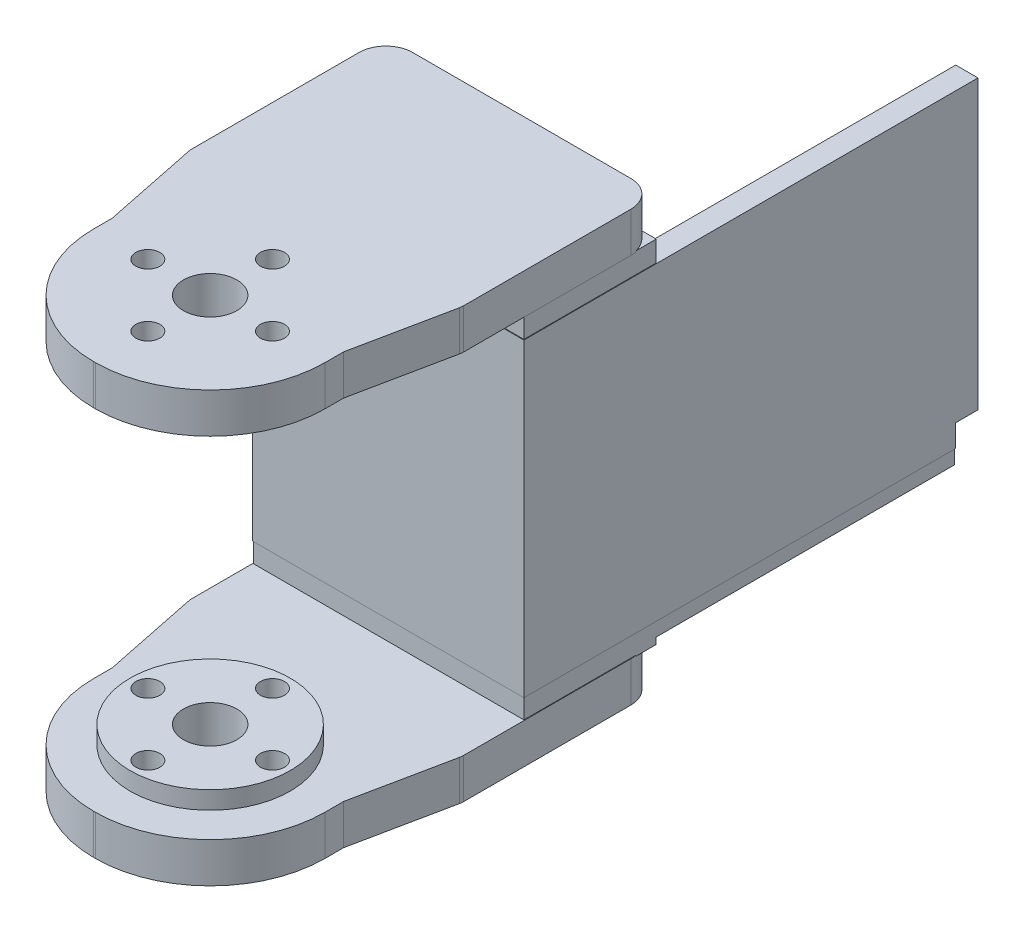
from build123d import *

# Parameters (mm, degrees)
BOSS_1_DEPTH    = 4.5
S_CYL2_R        = 9
BOSS_2_DEPTH    = 2
BOSS_3_DEPTH    = 4.5
S_BOX4_W        = 30.52
S_BOX4_H        = 34.8
BOSS_4_DEPTH    = 2.5
S_BOX5_W        = 2.5
S_BOX5_H        = 34.8
BOSS_5_DEPTH    = 51.02
S_BOX6_W        = 30.52
S_BOX6_H        = 2.4
BOSS_6_DEPTH    = 51.02
S_BOX7_W        = 2.5
S_BOX7_H        = 34.8
BOSS_7_DEPTH    = 18.01
S_BOX8_W        = 30.38
S_BOX8_H        = 2.675
BOSS_8_DEPTH    = 14.87
S_BOX9_W        = 30.38
S_BOX9_H        = 2.425
BOSS_9_DEPTH    = 14.87
S_BOX10_W       = 30.38
S_BOX10_H       = 1.65
BOSS_10_DEPTH   = 37.94
S_BOX11_W       = 5.59
S_BOX11_H       = 1.65
BOSS_11_DEPTH   = 10.54
S_BOX12_W       = 5.59
S_BOX12_H       = 1.65
BOSS_12_DEPTH   = 10.54
S_HOLE13_R      = 3
HOLE_13_DEPTH   = 4.7
S_HOLE14_R      = 1.35
HOLE_14_DEPTH   = 4.7
S_HOLE15_R      = 1.35
HOLE_15_DEPTH   = 4.7
S_HOLE16_R      = 1.35
HOLE_16_DEPTH   = 4.7
S_HOLE17_R      = 1.35
HOLE_17_DEPTH   = 4.7
S_HOLE18_R      = 3
HOLE_18_DEPTH   = 6.7
S_HOLE19_R      = 1.35
HOLE_19_DEPTH   = 6.7
S_HOLE20_R      = 1.35
HOLE_20_DEPTH   = 6.7
S_HOLE21_R      = 1.35
HOLE_21_DEPTH   = 6.7
S_HOLE22_R      = 1.35
HOLE_22_DEPTH   = 6.7
S_HOLE23_R      = 11
HOLE_23_DEPTH   = 2.6
S_HOLE24_R      = 1.1
HOLE_24_DEPTH   = 2.6
S_HOLE25_R      = 1.1
HOLE_25_DEPTH   = 2.6
S_HOLE26_R      = 1.1
HOLE_26_DEPTH   = 2.6
S_CUT27_W       = 30.72
S_CUT27_H       = 2.6
POCKET_27_DEPTH = 2.6
S_HOLE28_R      = 2.5
HOLE_28_DEPTH   = 5.175
S_HOLE29_R      = 2.5
HOLE_29_DEPTH   = 5.175
S_HOLE30_R      = 10
HOLE_30_DEPTH   = 1.8
S_HOLE31_R      = 1.1
HOLE_31_DEPTH   = 1.8
S_HOLE32_R      = 2.1
HOLE_32_DEPTH   = 1.7
S_HOLE33_R      = 1.1
HOLE_33_DEPTH   = 1.8
S_HOLE34_R      = 2.1
HOLE_34_DEPTH   = 1.7
S_HOLE35_R      = 1.1
HOLE_35_DEPTH   = 1.8
S_HOLE36_R      = 2.1
HOLE_36_DEPTH   = 1.7


with BuildPart() as part:
    # S_prism1 → Boss_1 (new body)
    with BuildSketch(Plane(origin=(0, 18.625, 0), x_dir=(1, 0, 0), z_dir=(0, 1, 0))):
        with BuildLine():
            Line((-13, 2), (-15.2191, 12.8008))
            ThreePointArc((-15.2191, 12.8008), (-15.249701872, 13.001018419), (-15.26, 13.2033))
            Line((-15.26, 13.2033), (-15.26, 32))
            ThreePointArc((-15.26, 32), (-14.3813, 34.1213), (-12.26, 35))
            Line((-12.26, 35), (12.26, 35))
            ThreePointArc((12.26, 35), (14.3813, 34.1213), (15.26, 32))
            Line((15.26, 32), (15.26, 13.2033))
            ThreePointArc((15.26, 13.2033), (15.249701872, 13.001018419), (15.2191, 12.8008))
            Line((15.2191, 12.8008), (13, 2))
            Line((13, 2), (13, -0.1))
            ThreePointArc((13, -0.1), (9.2217, -9.2217), (0.1, -13))
            Line((0.1, -13), (-0.1, -13))
            ThreePointArc((-0.1, -13), (-9.2217, -9.2217), (-13, -0.1))
            Line((-13, -0.1), (-13, 2))
        make_face()
    extrude(amount=BOSS_1_DEPTH)



with BuildPart() as body_2:
    # S_cyl2 → Boss_2 (new body)
    with BuildSketch(Plane(origin=(0, -20.625, 0), x_dir=(1, 0, 0), z_dir=(0, 1, 0))):
        Circle(S_CYL2_R)
    extrude(amount=BOSS_2_DEPTH)

    # S_prism3 → Boss_3 (add)
    with BuildSketch(Plane(origin=(0, -25.125, 0), x_dir=(1, 0, 0), z_dir=(0, 1, 0))):
        with BuildLine():
            Line((-13, 2), (-15.2191, 12.8008))
            ThreePointArc((-15.2191, 12.8008), (-15.249701872, 13.001018419), (-15.26, 13.2033))
            Line((-15.26, 13.2033), (-15.26, 32))
            ThreePointArc((-15.26, 32), (-14.3813, 34.1213), (-12.26, 35))
            Line((-12.26, 35), (12.26, 35))
            ThreePointArc((12.26, 35), (14.3813, 34.1213), (15.26, 32))
            Line((15.26, 32), (15.26, 13.2033))
            ThreePointArc((15.26, 13.2033), (15.249701872, 13.001018419), (15.2191, 12.8008))
            Line((15.2191, 12.8008), (13, 2))
            Line((13, 2), (13, -0.1))
            ThreePointArc((13, -0.1), (9.2217, -9.2217), (0.1, -13))
            Line((0.1, -13), (-0.1, -13))
            ThreePointArc((-0.1, -13), (-9.2217, -9.2217), (-13, -0.1))
            Line((-13, -0.1), (-13, 2))
        make_face()
    extrude(amount=BOSS_3_DEPTH)


with BuildPart() as body_3:
    # S_box4 → Boss_4 (new body)
    with BuildSketch(Plane.XY.offset(-22.49)):
        with Locations((0, -1)):
            Rectangle(S_BOX4_W, S_BOX4_H)
    extrude(amount=BOSS_4_DEPTH)

    # S_box5 → Boss_5 (add)
    with BuildSketch(Plane.XY.offset(-71.01)):
        with Locations((14.01, -1)):
            Rectangle(S_BOX5_W, S_BOX5_H)
    extrude(amount=BOSS_5_DEPTH)

    # S_box6 → Boss_6 (add)
    with BuildSketch(Plane.XY.offset(-71.01)):
        with Locations((0, -17.2)):
            Rectangle(S_BOX6_W, S_BOX6_H)
    extrude(amount=BOSS_6_DEPTH)

    # S_box7 → Boss_7 (add)
    with BuildSketch(Plane.XY.offset(-38)):
        with Locations((-14.01, -1)):
            Rectangle(S_BOX7_W, S_BOX7_H)
    extrude(amount=BOSS_7_DEPTH)


with BuildPart() as part_1:
    add(part.part)

    add(body_3.part)  # Boss_8 merges body 3
    # S_box8 → Boss_8 (add)
    with BuildSketch(Plane.XY.offset(-34.93)):
        with Locations((0, 17.3875)):
            Rectangle(S_BOX8_W, S_BOX8_H)
    extrude(amount=BOSS_8_DEPTH)


    add(body_2.part)  # Boss_9 merges body 2
    # S_box9 → Boss_9 (add)
    with BuildSketch(Plane.XY.offset(-34.93)):
        with Locations((0, -19.5125)):
            Rectangle(S_BOX9_W, S_BOX9_H)
    extrude(amount=BOSS_9_DEPTH)

    # S_box10 → Boss_10 (add)
    with BuildSketch(Plane.XY.offset(-58)):
        with Locations((0, -19.175)):
            Rectangle(S_BOX10_W, S_BOX10_H)
    extrude(amount=BOSS_10_DEPTH)

    # S_box11 → Boss_11 (add)
    with BuildSketch(Plane.XY.offset(-68.44)):
        with Locations((-12.395, -19.175)):
            Rectangle(S_BOX11_W, S_BOX11_H)
    extrude(amount=BOSS_11_DEPTH)

    # S_box12 → Boss_12 (add)
    with BuildSketch(Plane.XY.offset(-68.44)):
        with Locations((12.395, -19.175)):
            Rectangle(S_BOX12_W, S_BOX12_H)
    extrude(amount=BOSS_12_DEPTH)

    # S_hole13 → Hole_13 (cut)
    with BuildSketch(Plane(origin=(0, 18.525, 0), x_dir=(1, 0, 0), z_dir=(0, 1, 0))):
        Circle(S_HOLE13_R)
    extrude(amount=HOLE_13_DEPTH, mode=Mode.SUBTRACT)

    # S_hole14 → Hole_14 (cut)
    with BuildSketch(Plane(origin=(0, 18.525, 0), x_dir=(1, 0, 0), z_dir=(0, 1, 0))):
        with Locations((7, 0)):
            Circle(S_HOLE14_R)
    extrude(amount=HOLE_14_DEPTH, mode=Mode.SUBTRACT)

    # S_hole15 → Hole_15 (cut)
    with BuildSketch(Plane(origin=(0, 18.525, 0), x_dir=(1, 0, 0), z_dir=(0, 1, 0))):
        with Locations((0, -7)):
            Circle(S_HOLE15_R)
    extrude(amount=HOLE_15_DEPTH, mode=Mode.SUBTRACT)

    # S_hole16 → Hole_16 (cut)
    with BuildSketch(Plane(origin=(0, 18.525, 0), x_dir=(1, 0, 0), z_dir=(0, 1, 0))):
        with Locations((-7, 0)):
            Circle(S_HOLE16_R)
    extrude(amount=HOLE_16_DEPTH, mode=Mode.SUBTRACT)

    # S_hole17 → Hole_17 (cut)
    with BuildSketch(Plane(origin=(0, 18.525, 0), x_dir=(1, 0, 0), z_dir=(0, 1, 0))):
        with Locations((0, 7)):
            Circle(S_HOLE17_R)
    extrude(amount=HOLE_17_DEPTH, mode=Mode.SUBTRACT)

    # S_hole18 → Hole_18 (cut)
    with BuildSketch(Plane(origin=(0, -25.225, 0), x_dir=(1, 0, 0), z_dir=(0, 1, 0))):
        Circle(S_HOLE18_R)
    extrude(amount=HOLE_18_DEPTH, mode=Mode.SUBTRACT)

    # S_hole19 → Hole_19 (cut)
    with BuildSketch(Plane(origin=(0, -25.225, 0), x_dir=(1, 0, 0), z_dir=(0, 1, 0))):
        with Locations((7, 0)):
            Circle(S_HOLE19_R)
    extrude(amount=HOLE_19_DEPTH, mode=Mode.SUBTRACT)

    # S_hole20 → Hole_20 (cut)
    with BuildSketch(Plane(origin=(0, -25.225, 0), x_dir=(1, 0, 0), z_dir=(0, 1, 0))):
        with Locations((0, -7)):
            Circle(S_HOLE20_R)
    extrude(amount=HOLE_20_DEPTH, mode=Mode.SUBTRACT)

    # S_hole21 → Hole_21 (cut)
    with BuildSketch(Plane(origin=(0, -25.225, 0), x_dir=(1, 0, 0), z_dir=(0, 1, 0))):
        with Locations((-7, 0)):
            Circle(S_HOLE21_R)
    extrude(amount=HOLE_21_DEPTH, mode=Mode.SUBTRACT)

    # S_hole22 → Hole_22 (cut)
    with BuildSketch(Plane(origin=(0, -25.225, 0), x_dir=(1, 0, 0), z_dir=(0, 1, 0))):
        with Locations((0, 7)):
            Circle(S_HOLE22_R)
    extrude(amount=HOLE_22_DEPTH, mode=Mode.SUBTRACT)

    # S_hole23 → Hole_23 (cut)
    with BuildSketch(Plane(origin=(0, -18.5, 0), x_dir=(1, 0, 0), z_dir=(0, 1, 0))):
        with Locations((0, 58)):
            Circle(S_HOLE23_R)
    extrude(amount=HOLE_23_DEPTH, mode=Mode.SUBTRACT)

    # S_hole24 → Hole_24 (cut)
    with BuildSketch(Plane(origin=(0, -18.5, 0), x_dir=(1, 0, 0), z_dir=(0, 1, 0))):
        with Locations((10.25, 49.7)):
            Circle(S_HOLE24_R)
    extrude(amount=HOLE_24_DEPTH, mode=Mode.SUBTRACT)

    # S_hole25 → Hole_25 (cut)
    with BuildSketch(Plane(origin=(0, -18.5, 0), x_dir=(1, 0, 0), z_dir=(0, 1, 0))):
        with Locations((-10.25, 25.25)):
            Circle(S_HOLE25_R)
    extrude(amount=HOLE_25_DEPTH, mode=Mode.SUBTRACT)

    # S_hole26 → Hole_26 (cut)
    with BuildSketch(Plane(origin=(0, -18.5, 0), x_dir=(1, 0, 0), z_dir=(0, 1, 0))):
        with Locations((10.25, 25.25)):
            Circle(S_HOLE26_R)
    extrude(amount=HOLE_26_DEPTH, mode=Mode.SUBTRACT)

    # S_cut27 → Pocket_27 (cut)
    with BuildSketch(Plane.XY.offset(-71.11)):
        with Locations((0, -17.2)):
            Rectangle(S_CUT27_W, S_CUT27_H)
    extrude(amount=POCKET_27_DEPTH, mode=Mode.SUBTRACT)

    # S_hole28 → Hole_28 (cut)
    with BuildSketch(Plane(origin=(0, -25.225, 0), x_dir=(1, 0, 0), z_dir=(0, 1, 0))):
        with Locations((-10.25, 25.25)):
            Circle(S_HOLE28_R)
    extrude(amount=HOLE_28_DEPTH, mode=Mode.SUBTRACT)

    # S_hole29 → Hole_29 (cut)
    with BuildSketch(Plane(origin=(0, -25.225, 0), x_dir=(1, 0, 0), z_dir=(0, 1, 0))):
        with Locations((10.25, 25.25)):
            Circle(S_HOLE29_R)
    extrude(amount=HOLE_29_DEPTH, mode=Mode.SUBTRACT)

    # S_hole30 → Hole_30 (cut)
    with BuildSketch(Plane(origin=(0, -20.1, 0), x_dir=(1, 0, 0), z_dir=(0, 1, 0))):
        with Locations((0, 58)):
            Circle(S_HOLE30_R)
    extrude(amount=HOLE_30_DEPTH, mode=Mode.SUBTRACT)

    # S_hole31 → Hole_31 (cut)
    with BuildSketch(Plane(origin=(0, -20.1, 0), x_dir=(1, 0, 0), z_dir=(0, 1, 0))):
        with Locations((10.25, 49.7)):
            Circle(S_HOLE31_R)
    extrude(amount=HOLE_31_DEPTH, mode=Mode.SUBTRACT)

    # S_hole32 → Hole_32 (cut)
    with BuildSketch(Plane(origin=(0, -20.1, 0), x_dir=(1, 0, 0), z_dir=(0, 1, 0))):
        with Locations((10.25, 49.7)):
            Circle(S_HOLE32_R)
    extrude(amount=HOLE_32_DEPTH, mode=Mode.SUBTRACT)

    # S_hole33 → Hole_33 (cut)
    with BuildSketch(Plane(origin=(0, -20.1, 0), x_dir=(1, 0, 0), z_dir=(0, 1, 0))):
        with Locations((-10.25, 25.25)):
            Circle(S_HOLE33_R)
    extrude(amount=HOLE_33_DEPTH, mode=Mode.SUBTRACT)

    # S_hole34 → Hole_34 (cut)
    with BuildSketch(Plane(origin=(0, -20.1, 0), x_dir=(1, 0, 0), z_dir=(0, 1, 0))):
        with Locations((-10.25, 25.25)):
            Circle(S_HOLE34_R)
    extrude(amount=HOLE_34_DEPTH, mode=Mode.SUBTRACT)

    # S_hole35 → Hole_35 (cut)
    with BuildSketch(Plane(origin=(0, -20.1, 0), x_dir=(1, 0, 0), z_dir=(0, 1, 0))):
        with Locations((10.25, 25.25)):
            Circle(S_HOLE35_R)
    extrude(amount=HOLE_35_DEPTH, mode=Mode.SUBTRACT)

    # S_hole36 → Hole_36 (cut)
    with BuildSketch(Plane(origin=(0, -20.1, 0), x_dir=(1, 0, 0), z_dir=(0, 1, 0))):
        with Locations((10.25, 25.25)):
            Circle(S_HOLE36_R)
    extrude(amount=HOLE_36_DEPTH, mode=Mode.SUBTRACT)


solid = part_1.part
